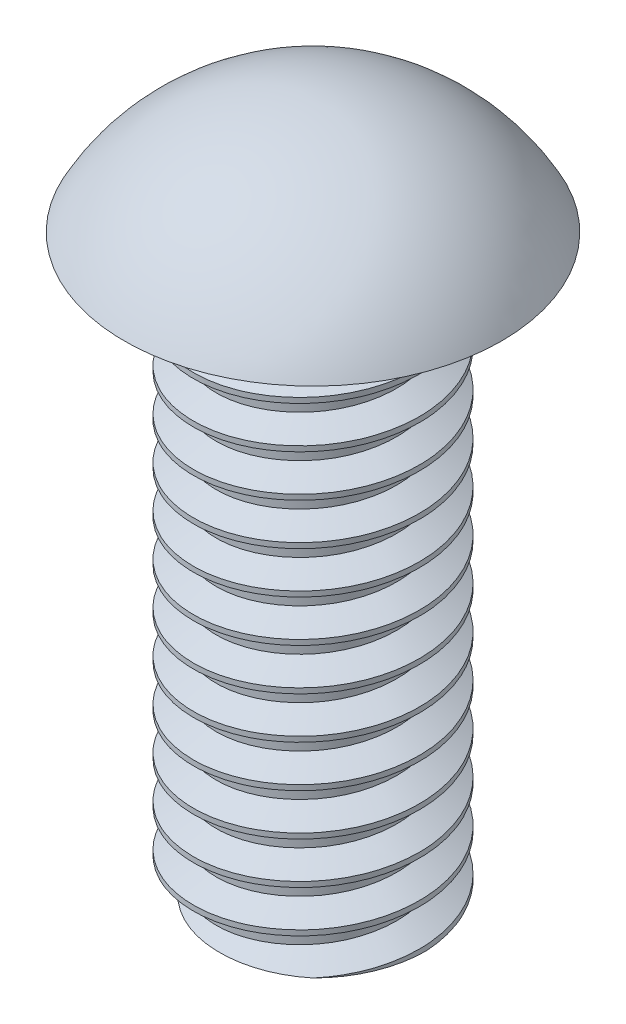
from build123d import *
from build123d.topology import SkipClean

# Parameters (mm, degrees)
THREAD1_PITCH = 1.411111111


with BuildPart() as part:
    # Sketch1 → Revolve1 (revolve)
    with BuildSketch(Plane.XY):
        with BuildLine():
            Line((9.782432432, 12.185135135), (12.322432432, 12.185135135))
            ThreePointArc((12.322432432, 12.185135135), (9.675086886, 14.969559224), (5.972432432, 15.995135135))
            Line((5.972432432, 15.995135135), (5.972432432, 12.185135135))
            Line((5.972432432, 12.185135135), (5.972432432, -6.864864865))
            Line((5.972432432, -6.864864865), (9.782432432, -6.864864865))
            Line((9.782432432, -6.864864865), (9.782432432, 12.185135135))
        make_face()
    revolve(axis=Axis((5.972432432, 12.185135135, 0), (0, -1, 0)))

    # Thread1: the profile of Thread Profile1 profile screwed along a right-hand helix of 13.5 turns, 8 arcs to a turn; built about Z, then put on its axis
    with SkipClean():  # the faces are left unmerged after this step: merging them gives an invalid solid
        thread1_z = Axis((0, 0, 0), (0, 0, 1))
        thread1_corners = [(3.8103, 0, -0.000173205), (3.8103, 0, 1.234895423), (3.046213709, 0, 0.793749998), (3.046213709, 0, 0.44097222)]
        with BuildLine(mode=Mode.PRIVATE) as thread1_profile:
            Line(thread1_corners[0], thread1_corners[1])
            Line(thread1_corners[1], thread1_corners[2])
            Line(thread1_corners[2], thread1_corners[3])
            Line(thread1_corners[3], thread1_corners[0])
        thread1_cap = Face(thread1_profile.wire())
        thread1_turn_angles = [0, 22.5, 45, 67.5, 90, 112.5, 135, 157.5, 180, 202.5, 225, 247.5, 270, 292.5, 315, 337.5, 360]
        thread1_turn_weights = [1, 0.9238795325112867, 1, 0.9238795325112867, 1, 0.9238795325112867, 1, 0.9238795325112867, 1, 0.9238795325112867, 1, 0.9238795325112867, 1, 0.9238795325112867, 1, 0.9238795325112867, 1]
        thread1_turn_rails = [Edge.make_bspline([Vector(p[0], p[1], 0).rotate(thread1_z, thread1_turn_angles[k]) / thread1_turn_weights[k] + Vector(0, 0, p[2] + THREAD1_PITCH * thread1_turn_angles[k] / 360) for k in range(17)], [0, 0, 0, 1, 1, 2, 2, 3, 3, 4, 4, 5, 5, 6, 6, 7, 7, 8, 8, 8], 2, thread1_turn_weights) for p in thread1_corners]
        thread1_turn_sides = [Face.make_surface_from_curves(thread1_turn_rails[p[0]], thread1_turn_rails[p[1]]) for p in [(0, 1), (1, 2), (2, 3), (3, 0)]]
        thread1_last_angles = [4680, 4702.5, 4725, 4747.5, 4770, 4792.5, 4815, 4837.5, 4860]
        thread1_last_weights = [1, 0.9238795325112867, 1, 0.9238795325112867, 1, 0.9238795325112867, 1, 0.9238795325112867, 1]
        thread1_last_rails = [Edge.make_bspline([Vector(p[0], p[1], 0).rotate(thread1_z, thread1_last_angles[k]) / thread1_last_weights[k] + Vector(0, 0, p[2] + THREAD1_PITCH * thread1_last_angles[k] / 360) for k in range(9)], [0, 0, 0, 1, 1, 2, 2, 3, 3, 4, 4, 4], 2, thread1_last_weights) for p in thread1_corners]
        thread1_last_sides = [Face.make_surface_from_curves(thread1_last_rails[p[0]], thread1_last_rails[p[1]]) for p in [(0, 1), (1, 2), (2, 3), (3, 0)]]
        thread1 = Plane(origin=(5.972432432, 12.185135135, 0), x_dir=(-1, 0, 0), z_dir=(0, -1, 0)) * Solid(Shell([*[p.moved(Location((0, 0, THREAD1_PITCH * i))) for i in range(13) for p in thread1_turn_sides], *thread1_last_sides, thread1_cap, thread1_cap.rotate(thread1_z, 4860).moved(Location((0, 0, THREAD1_PITCH * 4860 / 360)))]))
        add(thread1, mode=Mode.SUBTRACT)


solid = part.part
